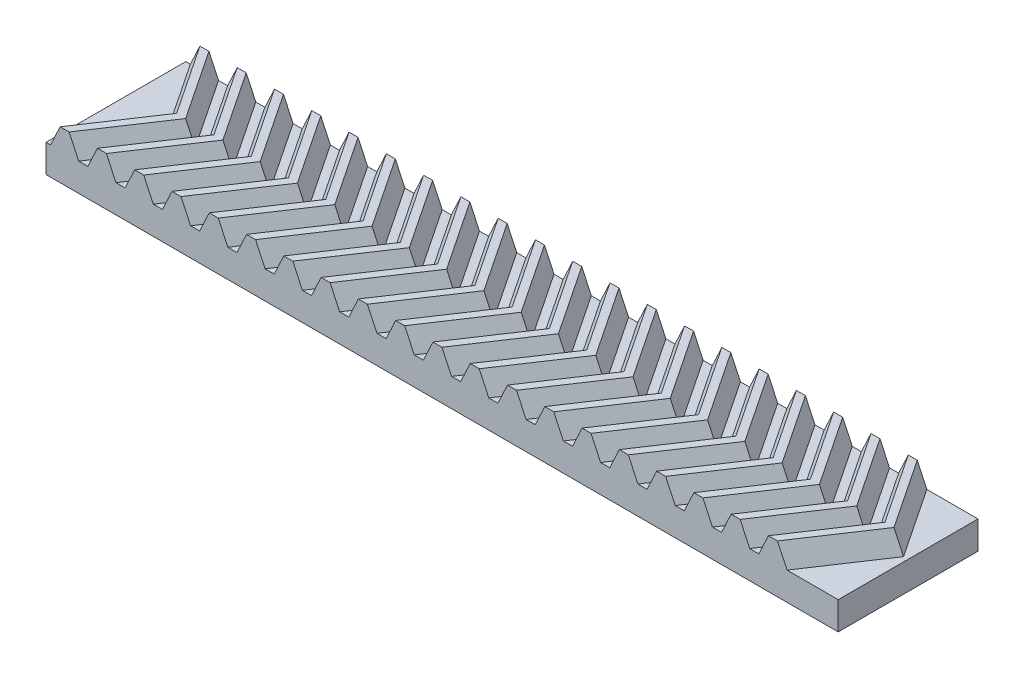
from build123d import *

# Parameters (mm, degrees)
SKETCH3_W                    = 9
SKETCH3_H                    = 3
EXTRUDE_END_DEPTH            = 7.5
PATTERN_START                = -3
PATTERN_HALF_TEETH_OUTLINE_W = 76
PATTERN_HALF_TEETH_OUTLINE_H = 7.5
PATTERN_HALF_TEETH_DEPTH     = 3


with BuildPart() as part:
    # Sweep Half Tooth: sweep along a path in Sketch2
    with BuildLine(Plane(origin=(0, 0, 0), x_dir=(1, 0, 0), z_dir=(0, 1, 0))) as sweep_half_tooth_path:
        Line((0, 0), (-5, -7.5))
    # Sketch1 → Sweep Half Tooth (sweep)
    with BuildSketch(Plane.XY):
        Polygon((-0.483692342, 2.2), (0.483692342, 2.2), (1.50956919, 0), (2, 0), (2, -3), (-2, -3), (-2, 0), (-1.50956919, 0), align=None)
    sweep(path=sweep_half_tooth_path.line)

    # Sketch3 → Extrude End (add)
    with BuildSketch(Plane.XY):
        with Locations((-2.5, -1.5)):
            Rectangle(SKETCH3_W, SKETCH3_H)
    extrude(amount=EXTRUDE_END_DEPTH)

    # Pattern Half Teeth: read off the stored shape, not the designer's step
    # Pattern Half Teeth outline → Pattern Half Teeth (add)
    with BuildSketch(Plane(origin=(0, 0, 0), x_dir=(1, 0, 0), z_dir=(0, 1, 0)).offset(PATTERN_START)):
        with Locations((40, -3.75)):
            Rectangle(PATTERN_HALF_TEETH_OUTLINE_W, PATTERN_HALF_TEETH_OUTLINE_H)
    extrude(amount=PATTERN_HALF_TEETH_DEPTH)

    # Pattern Half Teeth 2: loft between two sections, ruled curve by curve
    pattern_half_teeth_2_from = [
        Edge.make_line((0.50956919, 0, 7.5), (5.50956919, 0, 0)),
        Edge.make_line((2.49043081, 0, 0), (-2.50956919, 0, 7.5)),
        Edge.make_line((2.49043081, 0, 0), (5.50956919, 0, 0)),
        Edge.make_line((-2.50956919, 0, 7.5), (0.50956919, 0, 7.5)),
    ]
    pattern_half_teeth_2_to = [
        Edge.make_line((-0.516307658, 2.2, 7.5), (4.483692342, 2.2, 0)),
        Edge.make_line((3.516307658, 2.2, 0), (-1.483692342, 2.2, 7.5)),
        Edge.make_line((3.516307658, 2.2, 0), (4.483692342, 2.2, 0)),
        Edge.make_line((-1.483692342, 2.2, 7.5), (-0.516307658, 2.2, 7.5)),
    ]
    pattern_half_teeth_2 = Solid(Shell([*[Face.make_surface_from_curves(pattern_half_teeth_2_from[k], pattern_half_teeth_2_to[k]) for k in range(4)], Face(Wire(pattern_half_teeth_2_from)), Face(Wire(pattern_half_teeth_2_to))]))
    add(pattern_half_teeth_2)

    # Pattern Half Teeth 3: loft between two sections, ruled curve by curve
    pattern_half_teeth_3_from = [
        Edge.make_line((4.50956919, 0, 7.5), (9.50956919, 0, 0)),
        Edge.make_line((6.49043081, 0, 0), (1.49043081, 0, 7.5)),
        Edge.make_line((1.49043081, 0, 7.5), (4.50956919, 0, 7.5)),
        Edge.make_line((6.49043081, 0, 0), (9.50956919, 0, 0)),
    ]
    pattern_half_teeth_3_to = [
        Edge.make_line((3.483692342, 2.2, 7.5), (8.483692342, 2.2, 0)),
        Edge.make_line((7.516307658, 2.2, 0), (2.516307658, 2.2, 7.5)),
        Edge.make_line((2.516307658, 2.2, 7.5), (3.483692342, 2.2, 7.5)),
        Edge.make_line((7.516307658, 2.2, 0), (8.483692342, 2.2, 0)),
    ]
    pattern_half_teeth_3 = Solid(Shell([*[Face.make_surface_from_curves(pattern_half_teeth_3_from[k], pattern_half_teeth_3_to[k]) for k in range(4)], Face(Wire(pattern_half_teeth_3_from)), Face(Wire(pattern_half_teeth_3_to))]))
    add(pattern_half_teeth_3)

    # Pattern Half Teeth 4: loft between two sections, ruled curve by curve
    pattern_half_teeth_4_from = [
        Edge.make_line((8.50956919, 0, 7.5), (13.50956919, 0, 0)),
        Edge.make_line((10.49043081, 0, 0), (5.49043081, 0, 7.5)),
        Edge.make_line((5.49043081, 0, 7.5), (8.50956919, 0, 7.5)),
        Edge.make_line((10.49043081, 0, 0), (13.50956919, 0, 0)),
    ]
    pattern_half_teeth_4_to = [
        Edge.make_line((7.483692342, 2.2, 7.5), (12.483692342, 2.2, 0)),
        Edge.make_line((11.516307658, 2.2, 0), (6.516307658, 2.2, 7.5)),
        Edge.make_line((6.516307658, 2.2, 7.5), (7.483692342, 2.2, 7.5)),
        Edge.make_line((11.516307658, 2.2, 0), (12.483692342, 2.2, 0)),
    ]
    pattern_half_teeth_4 = Solid(Shell([*[Face.make_surface_from_curves(pattern_half_teeth_4_from[k], pattern_half_teeth_4_to[k]) for k in range(4)], Face(Wire(pattern_half_teeth_4_from)), Face(Wire(pattern_half_teeth_4_to))]))
    add(pattern_half_teeth_4)

    # Pattern Half Teeth 5: loft between two sections, ruled curve by curve
    pattern_half_teeth_5_from = [
        Edge.make_line((12.50956919, 0, 7.5), (17.50956919, 0, 0)),
        Edge.make_line((14.49043081, 0, 0), (9.49043081, 0, 7.5)),
        Edge.make_line((14.49043081, 0, 0), (17.50956919, 0, 0)),
        Edge.make_line((9.49043081, 0, 7.5), (12.50956919, 0, 7.5)),
    ]
    pattern_half_teeth_5_to = [
        Edge.make_line((11.483692342, 2.2, 7.5), (16.483692342, 2.2, 0)),
        Edge.make_line((15.516307658, 2.2, 0), (10.516307658, 2.2, 7.5)),
        Edge.make_line((15.516307658, 2.2, 0), (16.483692342, 2.2, 0)),
        Edge.make_line((10.516307658, 2.2, 7.5), (11.483692342, 2.2, 7.5)),
    ]
    pattern_half_teeth_5 = Solid(Shell([*[Face.make_surface_from_curves(pattern_half_teeth_5_from[k], pattern_half_teeth_5_to[k]) for k in range(4)], Face(Wire(pattern_half_teeth_5_from)), Face(Wire(pattern_half_teeth_5_to))]))
    add(pattern_half_teeth_5)

    # Pattern Half Teeth 6: loft between two sections, ruled curve by curve
    pattern_half_teeth_6_from = [
        Edge.make_line((16.50956919, 0, 7.5), (21.50956919, 0, 0)),
        Edge.make_line((18.49043081, 0, 0), (13.49043081, 0, 7.5)),
        Edge.make_line((18.49043081, 0, 0), (21.50956919, 0, 0)),
        Edge.make_line((13.49043081, 0, 7.5), (16.50956919, 0, 7.5)),
    ]
    pattern_half_teeth_6_to = [
        Edge.make_line((15.483692342, 2.2, 7.5), (20.483692342, 2.2, 0)),
        Edge.make_line((19.516307658, 2.2, 0), (14.516307658, 2.2, 7.5)),
        Edge.make_line((19.516307658, 2.2, 0), (20.483692342, 2.2, 0)),
        Edge.make_line((14.516307658, 2.2, 7.5), (15.483692342, 2.2, 7.5)),
    ]
    pattern_half_teeth_6 = Solid(Shell([*[Face.make_surface_from_curves(pattern_half_teeth_6_from[k], pattern_half_teeth_6_to[k]) for k in range(4)], Face(Wire(pattern_half_teeth_6_from)), Face(Wire(pattern_half_teeth_6_to))]))
    add(pattern_half_teeth_6)

    # Pattern Half Teeth 7: loft between two sections, ruled curve by curve
    pattern_half_teeth_7_from = [
        Edge.make_line((20.50956919, 0, 7.5), (25.50956919, 0, 0)),
        Edge.make_line((22.49043081, 0, 0), (17.49043081, 0, 7.5)),
        Edge.make_line((22.49043081, 0, 0), (25.50956919, 0, 0)),
        Edge.make_line((17.49043081, 0, 7.5), (20.50956919, 0, 7.5)),
    ]
    pattern_half_teeth_7_to = [
        Edge.make_line((19.483692342, 2.2, 7.5), (24.483692342, 2.2, 0)),
        Edge.make_line((23.516307658, 2.2, 0), (18.516307658, 2.2, 7.5)),
        Edge.make_line((23.516307658, 2.2, 0), (24.483692342, 2.2, 0)),
        Edge.make_line((18.516307658, 2.2, 7.5), (19.483692342, 2.2, 7.5)),
    ]
    pattern_half_teeth_7 = Solid(Shell([*[Face.make_surface_from_curves(pattern_half_teeth_7_from[k], pattern_half_teeth_7_to[k]) for k in range(4)], Face(Wire(pattern_half_teeth_7_from)), Face(Wire(pattern_half_teeth_7_to))]))
    add(pattern_half_teeth_7)

    # Pattern Half Teeth 8: loft between two sections, ruled curve by curve
    pattern_half_teeth_8_from = [
        Edge.make_line((24.50956919, 0, 7.5), (29.50956919, 0, 0)),
        Edge.make_line((26.49043081, 0, 0), (21.49043081, 0, 7.5)),
        Edge.make_line((26.49043081, 0, 0), (29.50956919, 0, 0)),
        Edge.make_line((21.49043081, 0, 7.5), (24.50956919, 0, 7.5)),
    ]
    pattern_half_teeth_8_to = [
        Edge.make_line((23.483692342, 2.2, 7.5), (28.483692342, 2.2, 0)),
        Edge.make_line((27.516307658, 2.2, 0), (22.516307658, 2.2, 7.5)),
        Edge.make_line((27.516307658, 2.2, 0), (28.483692342, 2.2, 0)),
        Edge.make_line((22.516307658, 2.2, 7.5), (23.483692342, 2.2, 7.5)),
    ]
    pattern_half_teeth_8 = Solid(Shell([*[Face.make_surface_from_curves(pattern_half_teeth_8_from[k], pattern_half_teeth_8_to[k]) for k in range(4)], Face(Wire(pattern_half_teeth_8_from)), Face(Wire(pattern_half_teeth_8_to))]))
    add(pattern_half_teeth_8)

    # Pattern Half Teeth 9: loft between two sections, ruled curve by curve
    pattern_half_teeth_9_from = [
        Edge.make_line((28.50956919, 0, 7.5), (33.50956919, 0, 0)),
        Edge.make_line((30.49043081, 0, 0), (25.49043081, 0, 7.5)),
        Edge.make_line((30.49043081, 0, 0), (33.50956919, 0, 0)),
        Edge.make_line((25.49043081, 0, 7.5), (28.50956919, 0, 7.5)),
    ]
    pattern_half_teeth_9_to = [
        Edge.make_line((27.483692342, 2.2, 7.5), (32.483692342, 2.2, 0)),
        Edge.make_line((31.516307658, 2.2, 0), (26.516307658, 2.2, 7.5)),
        Edge.make_line((31.516307658, 2.2, 0), (32.483692342, 2.2, 0)),
        Edge.make_line((26.516307658, 2.2, 7.5), (27.483692342, 2.2, 7.5)),
    ]
    pattern_half_teeth_9 = Solid(Shell([*[Face.make_surface_from_curves(pattern_half_teeth_9_from[k], pattern_half_teeth_9_to[k]) for k in range(4)], Face(Wire(pattern_half_teeth_9_from)), Face(Wire(pattern_half_teeth_9_to))]))
    add(pattern_half_teeth_9)

    # Pattern Half Teeth 10: loft between two sections, ruled curve by curve
    pattern_half_teeth_10_from = [
        Edge.make_line((32.50956919, 0, 7.5), (37.50956919, 0, 0)),
        Edge.make_line((34.49043081, 0, 0), (29.49043081, 0, 7.5)),
        Edge.make_line((34.49043081, 0, 0), (37.50956919, 0, 0)),
        Edge.make_line((29.49043081, 0, 7.5), (32.50956919, 0, 7.5)),
    ]
    pattern_half_teeth_10_to = [
        Edge.make_line((31.483692342, 2.2, 7.5), (36.483692342, 2.2, 0)),
        Edge.make_line((35.516307658, 2.2, 0), (30.516307658, 2.2, 7.5)),
        Edge.make_line((35.516307658, 2.2, 0), (36.483692342, 2.2, 0)),
        Edge.make_line((30.516307658, 2.2, 7.5), (31.483692342, 2.2, 7.5)),
    ]
    pattern_half_teeth_10 = Solid(Shell([*[Face.make_surface_from_curves(pattern_half_teeth_10_from[k], pattern_half_teeth_10_to[k]) for k in range(4)], Face(Wire(pattern_half_teeth_10_from)), Face(Wire(pattern_half_teeth_10_to))]))
    add(pattern_half_teeth_10)

    # Pattern Half Teeth 11: loft between two sections, ruled curve by curve
    pattern_half_teeth_11_from = [
        Edge.make_line((36.50956919, 0, 7.5), (41.50956919, 0, 0)),
        Edge.make_line((38.49043081, 0, 0), (33.49043081, 0, 7.5)),
        Edge.make_line((38.49043081, 0, 0), (41.50956919, 0, 0)),
        Edge.make_line((33.49043081, 0, 7.5), (36.50956919, 0, 7.5)),
    ]
    pattern_half_teeth_11_to = [
        Edge.make_line((35.483692342, 2.2, 7.5), (40.483692342, 2.2, 0)),
        Edge.make_line((39.516307658, 2.2, 0), (34.516307658, 2.2, 7.5)),
        Edge.make_line((39.516307658, 2.2, 0), (40.483692342, 2.2, 0)),
        Edge.make_line((34.516307658, 2.2, 7.5), (35.483692342, 2.2, 7.5)),
    ]
    pattern_half_teeth_11 = Solid(Shell([*[Face.make_surface_from_curves(pattern_half_teeth_11_from[k], pattern_half_teeth_11_to[k]) for k in range(4)], Face(Wire(pattern_half_teeth_11_from)), Face(Wire(pattern_half_teeth_11_to))]))
    add(pattern_half_teeth_11)

    # Pattern Half Teeth 12: loft between two sections, ruled curve by curve
    pattern_half_teeth_12_from = [
        Edge.make_line((40.50956919, 0, 7.5), (45.50956919, 0, 0)),
        Edge.make_line((42.49043081, 0, 0), (37.49043081, 0, 7.5)),
        Edge.make_line((42.49043081, 0, 0), (45.50956919, 0, 0)),
        Edge.make_line((37.49043081, 0, 7.5), (40.50956919, 0, 7.5)),
    ]
    pattern_half_teeth_12_to = [
        Edge.make_line((39.483692342, 2.2, 7.5), (44.483692342, 2.2, 0)),
        Edge.make_line((43.516307658, 2.2, 0), (38.516307658, 2.2, 7.5)),
        Edge.make_line((43.516307658, 2.2, 0), (44.483692342, 2.2, 0)),
        Edge.make_line((38.516307658, 2.2, 7.5), (39.483692342, 2.2, 7.5)),
    ]
    pattern_half_teeth_12 = Solid(Shell([*[Face.make_surface_from_curves(pattern_half_teeth_12_from[k], pattern_half_teeth_12_to[k]) for k in range(4)], Face(Wire(pattern_half_teeth_12_from)), Face(Wire(pattern_half_teeth_12_to))]))
    add(pattern_half_teeth_12)

    # Pattern Half Teeth 13: loft between two sections, ruled curve by curve
    pattern_half_teeth_13_from = [
        Edge.make_line((44.50956919, 0, 7.5), (49.50956919, 0, 0)),
        Edge.make_line((46.49043081, 0, 0), (41.49043081, 0, 7.5)),
        Edge.make_line((46.49043081, 0, 0), (49.50956919, 0, 0)),
        Edge.make_line((41.49043081, 0, 7.5), (44.50956919, 0, 7.5)),
    ]
    pattern_half_teeth_13_to = [
        Edge.make_line((43.483692342, 2.2, 7.5), (48.483692342, 2.2, 0)),
        Edge.make_line((47.516307658, 2.2, 0), (42.516307658, 2.2, 7.5)),
        Edge.make_line((47.516307658, 2.2, 0), (48.483692342, 2.2, 0)),
        Edge.make_line((42.516307658, 2.2, 7.5), (43.483692342, 2.2, 7.5)),
    ]
    pattern_half_teeth_13 = Solid(Shell([*[Face.make_surface_from_curves(pattern_half_teeth_13_from[k], pattern_half_teeth_13_to[k]) for k in range(4)], Face(Wire(pattern_half_teeth_13_from)), Face(Wire(pattern_half_teeth_13_to))]))
    add(pattern_half_teeth_13)

    # Pattern Half Teeth 14: loft between two sections, ruled curve by curve
    pattern_half_teeth_14_from = [
        Edge.make_line((48.50956919, 0, 7.5), (53.50956919, 0, 0)),
        Edge.make_line((50.49043081, 0, 0), (45.49043081, 0, 7.5)),
        Edge.make_line((50.49043081, 0, 0), (53.50956919, 0, 0)),
        Edge.make_line((45.49043081, 0, 7.5), (48.50956919, 0, 7.5)),
    ]
    pattern_half_teeth_14_to = [
        Edge.make_line((47.483692342, 2.2, 7.5), (52.483692342, 2.2, 0)),
        Edge.make_line((51.516307658, 2.2, 0), (46.516307658, 2.2, 7.5)),
        Edge.make_line((51.516307658, 2.2, 0), (52.483692342, 2.2, 0)),
        Edge.make_line((46.516307658, 2.2, 7.5), (47.483692342, 2.2, 7.5)),
    ]
    pattern_half_teeth_14 = Solid(Shell([*[Face.make_surface_from_curves(pattern_half_teeth_14_from[k], pattern_half_teeth_14_to[k]) for k in range(4)], Face(Wire(pattern_half_teeth_14_from)), Face(Wire(pattern_half_teeth_14_to))]))
    add(pattern_half_teeth_14)

    # Pattern Half Teeth 15: loft between two sections, ruled curve by curve
    pattern_half_teeth_15_from = [
        Edge.make_line((52.50956919, 0, 7.5), (57.50956919, 0, 0)),
        Edge.make_line((54.49043081, 0, 0), (49.49043081, 0, 7.5)),
        Edge.make_line((54.49043081, 0, 0), (57.50956919, 0, 0)),
        Edge.make_line((49.49043081, 0, 7.5), (52.50956919, 0, 7.5)),
    ]
    pattern_half_teeth_15_to = [
        Edge.make_line((51.483692342, 2.2, 7.5), (56.483692342, 2.2, 0)),
        Edge.make_line((55.516307658, 2.2, 0), (50.516307658, 2.2, 7.5)),
        Edge.make_line((55.516307658, 2.2, 0), (56.483692342, 2.2, 0)),
        Edge.make_line((50.516307658, 2.2, 7.5), (51.483692342, 2.2, 7.5)),
    ]
    pattern_half_teeth_15 = Solid(Shell([*[Face.make_surface_from_curves(pattern_half_teeth_15_from[k], pattern_half_teeth_15_to[k]) for k in range(4)], Face(Wire(pattern_half_teeth_15_from)), Face(Wire(pattern_half_teeth_15_to))]))
    add(pattern_half_teeth_15)

    # Pattern Half Teeth 16: loft between two sections, ruled curve by curve
    pattern_half_teeth_16_from = [
        Edge.make_line((56.50956919, 0, 7.5), (61.50956919, 0, 0)),
        Edge.make_line((58.49043081, 0, 0), (53.49043081, 0, 7.5)),
        Edge.make_line((58.49043081, 0, 0), (61.50956919, 0, 0)),
        Edge.make_line((53.49043081, 0, 7.5), (56.50956919, 0, 7.5)),
    ]
    pattern_half_teeth_16_to = [
        Edge.make_line((55.483692342, 2.2, 7.5), (60.483692342, 2.2, 0)),
        Edge.make_line((59.516307658, 2.2, 0), (54.516307658, 2.2, 7.5)),
        Edge.make_line((59.516307658, 2.2, 0), (60.483692342, 2.2, 0)),
        Edge.make_line((54.516307658, 2.2, 7.5), (55.483692342, 2.2, 7.5)),
    ]
    pattern_half_teeth_16 = Solid(Shell([*[Face.make_surface_from_curves(pattern_half_teeth_16_from[k], pattern_half_teeth_16_to[k]) for k in range(4)], Face(Wire(pattern_half_teeth_16_from)), Face(Wire(pattern_half_teeth_16_to))]))
    add(pattern_half_teeth_16)

    # Pattern Half Teeth 17: loft between two sections, ruled curve by curve
    pattern_half_teeth_17_from = [
        Edge.make_line((60.50956919, 0, 7.5), (65.50956919, 0, 0)),
        Edge.make_line((62.49043081, 0, 0), (57.49043081, 0, 7.5)),
        Edge.make_line((62.49043081, 0, 0), (65.50956919, 0, 0)),
        Edge.make_line((57.49043081, 0, 7.5), (60.50956919, 0, 7.5)),
    ]
    pattern_half_teeth_17_to = [
        Edge.make_line((59.483692342, 2.2, 7.5), (64.483692342, 2.2, 0)),
        Edge.make_line((63.516307658, 2.2, 0), (58.516307658, 2.2, 7.5)),
        Edge.make_line((63.516307658, 2.2, 0), (64.483692342, 2.2, 0)),
        Edge.make_line((58.516307658, 2.2, 7.5), (59.483692342, 2.2, 7.5)),
    ]
    pattern_half_teeth_17 = Solid(Shell([*[Face.make_surface_from_curves(pattern_half_teeth_17_from[k], pattern_half_teeth_17_to[k]) for k in range(4)], Face(Wire(pattern_half_teeth_17_from)), Face(Wire(pattern_half_teeth_17_to))]))
    add(pattern_half_teeth_17)

    # Pattern Half Teeth 18: loft between two sections, ruled curve by curve
    pattern_half_teeth_18_from = [
        Edge.make_line((64.50956919, 0, 7.5), (69.50956919, 0, 0)),
        Edge.make_line((66.49043081, 0, 0), (61.49043081, 0, 7.5)),
        Edge.make_line((66.49043081, 0, 0), (69.50956919, 0, 0)),
        Edge.make_line((61.49043081, 0, 7.5), (64.50956919, 0, 7.5)),
    ]
    pattern_half_teeth_18_to = [
        Edge.make_line((63.483692342, 2.2, 7.5), (68.483692342, 2.2, 0)),
        Edge.make_line((67.516307658, 2.2, 0), (62.516307658, 2.2, 7.5)),
        Edge.make_line((67.516307658, 2.2, 0), (68.483692342, 2.2, 0)),
        Edge.make_line((62.516307658, 2.2, 7.5), (63.483692342, 2.2, 7.5)),
    ]
    pattern_half_teeth_18 = Solid(Shell([*[Face.make_surface_from_curves(pattern_half_teeth_18_from[k], pattern_half_teeth_18_to[k]) for k in range(4)], Face(Wire(pattern_half_teeth_18_from)), Face(Wire(pattern_half_teeth_18_to))]))
    add(pattern_half_teeth_18)

    # Pattern Half Teeth 19: loft between two sections, ruled curve by curve
    pattern_half_teeth_19_from = [
        Edge.make_line((68.50956919, 0, 7.5), (73.50956919, 0, 0)),
        Edge.make_line((70.49043081, 0, 0), (65.49043081, 0, 7.5)),
        Edge.make_line((70.49043081, 0, 0), (73.50956919, 0, 0)),
        Edge.make_line((65.49043081, 0, 7.5), (68.50956919, 0, 7.5)),
    ]
    pattern_half_teeth_19_to = [
        Edge.make_line((67.483692342, 2.2, 7.5), (72.483692342, 2.2, 0)),
        Edge.make_line((71.516307658, 2.2, 0), (66.516307658, 2.2, 7.5)),
        Edge.make_line((71.516307658, 2.2, 0), (72.483692342, 2.2, 0)),
        Edge.make_line((66.516307658, 2.2, 7.5), (67.483692342, 2.2, 7.5)),
    ]
    pattern_half_teeth_19 = Solid(Shell([*[Face.make_surface_from_curves(pattern_half_teeth_19_from[k], pattern_half_teeth_19_to[k]) for k in range(4)], Face(Wire(pattern_half_teeth_19_from)), Face(Wire(pattern_half_teeth_19_to))]))
    add(pattern_half_teeth_19)

    # Pattern Half Teeth 20: loft between two sections, ruled curve by curve
    pattern_half_teeth_20_from = [
        Edge.make_line((72.50956919, 0, 7.5), (77.50956919, 0, 0)),
        Edge.make_line((74.49043081, 0, 0), (69.49043081, 0, 7.5)),
        Edge.make_line((74.49043081, 0, 0), (77.50956919, 0, 0)),
        Edge.make_line((69.49043081, 0, 7.5), (72.50956919, 0, 7.5)),
    ]
    pattern_half_teeth_20_to = [
        Edge.make_line((71.483692342, 2.2, 7.5), (76.483692342, 2.2, 0)),
        Edge.make_line((75.516307658, 2.2, 0), (70.516307658, 2.2, 7.5)),
        Edge.make_line((75.516307658, 2.2, 0), (76.483692342, 2.2, 0)),
        Edge.make_line((70.516307658, 2.2, 7.5), (71.483692342, 2.2, 7.5)),
    ]
    pattern_half_teeth_20 = Solid(Shell([*[Face.make_surface_from_curves(pattern_half_teeth_20_from[k], pattern_half_teeth_20_to[k]) for k in range(4)], Face(Wire(pattern_half_teeth_20_from)), Face(Wire(pattern_half_teeth_20_to))]))
    add(pattern_half_teeth_20)

    # Mirror Teeth: part across plane


with BuildPart() as part_1:
    add(part.part)
    add(part.part.mirror(Plane.XY))


solid = part_1.part
